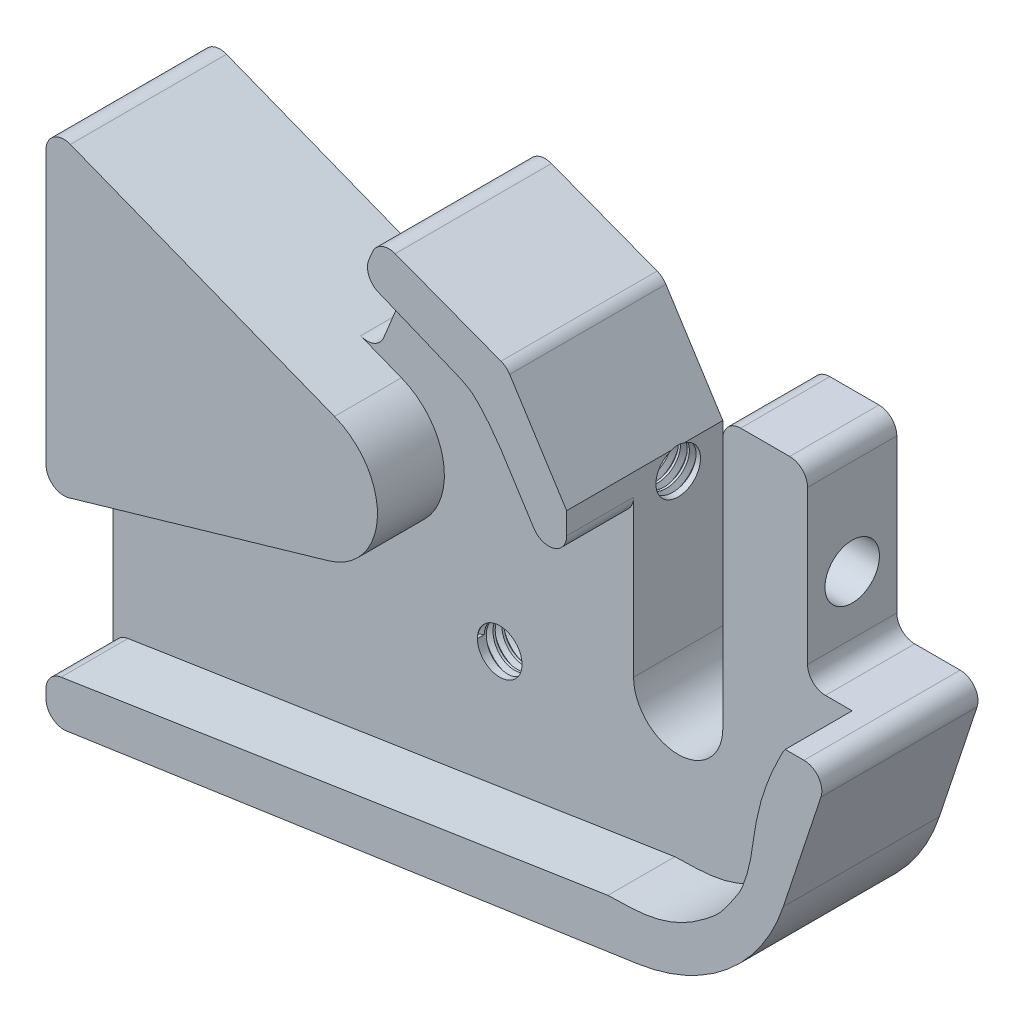
from build123d import *

# Parameters (mm, degrees)
BOSS_EXTRUDE1_DEPTH             = 10
SKETCH1_3_R                     = 7.578000113984699
BOSS_EXTRUDE2_DEPTH             = 17.5
FILLET1_R                       = 2
SKETCH4_R                       = 3.049999999999998
CUT_EXTRUDE2_DEPTH              = 30
TAP_DRILL_FOR_M6X1_0_TAP3_D     = 5
TAP_DRILL_FOR_M6X1_0_TAP3_DEPTH = 30
TAP_DRILL_FOR_M6X1_0_TAP3_TIP   = 1.5021515475689007
THREAD2_PITCH                   = 1
TAP_DRILL_FOR_M6X1_0_TAP4_D     = 5
TAP_DRILL_FOR_M6X1_0_TAP4_DEPTH = 30
TAP_DRILL_FOR_M6X1_0_TAP4_TIP   = 1.5021515475689007
THREAD3_PITCH                   = 1


with BuildPart() as part:
    # Sketch1 → Boss-Extrude1 (new body)
    with BuildSketch(Plane.XY):
        with BuildLine():
            Line((78.96827475522947, 38.5935556342534), (78.96827475522947, 42.187825253742076))
            Line((78.96827475522947, 42.187825253742076), (77.94135898527813, 43.80236991179886))
            Line((77.94135898527813, 43.80236991179886), (74.33675739276399, 49.46962171171273))
            ThreePointArc((74.33675739276399, 49.469621711712726), (63.68877245881805, 32.62392048177763), (72.57453232318737, 14.785744994510448))
            Line((72.57453232318733, 14.785744994510328), (83.59996436724236, 16.48818112450211))
            add(Edge.make_bspline(
                [(83.59996436724236, 16.48818112450211), (85.41724211796233, 16.537565687608662), (87.87798883539779, 16.519220276594933), (90.67264688620305, 17.420541267562605), (92.39490917260518, 18.177313617681204), (94.09982159977741, 19.33727905205282), (95.76190532502258, 20.584169739397396), (96.83810880091103, 21.89338889229207), (97.57220809756222, 23.02149502182194), (98.2993424213877, 24.012698516640828), (98.8168110615546, 25.180735972728453), (99.33817141463199, 26.79477159166982), (99.7545174529146, 28.73305881299975), (99.97921580397463, 30.878234339552698), (100.41119186805446, 32.8730475280245), (100.84339117053995, 34.69276986008276), (101.41680498340376, 36.208847575811006), (101.85717784527547, 37.44613777913256), (102.35269954460531, 38.40363385947975), (102.63825521054652, 39.04344915294927), (102.75433193083815, 39.30094954555371)],
                knots=[0, 0, 0, 0, 0.15768366072338366, 0.20676134981541355, 0.2516981863893839, 0.31900050382694334, 0.38365759589069376, 0.42951420214431174, 0.46378751400899093, 0.4995429911697522, 0.5348783172354219, 0.5730312186558052, 0.6454047552386061, 0.7048490244263054, 0.7583603601988523, 0.8208523578081605, 0.8654225677826217, 0.8976768321542437, 0.9336890739628735, 0.9579711653352324, 0.9579711653352324, 0.9579711653352324, 0.9579711653352324], degree=3))
            ThreePointArc((102.75433193083765, 39.30094954555368), (102.4765938343829, 39.94591996858493), (102.17672020405834, 40.5809011514899))
            Line((102.17672020405828, 40.58090115148971), (98.46827475522947, 40.58090115148971))
            Line((98.46827475522947, 40.58090115148971), (98.46827475522947, 45.80868367128349))
            ThreePointArc((98.46827475522967, 45.80868367128356), (94.09398060149493, 49.19440635869487), (88.96827475522964, 51.273999356618106))
            Line((88.96827475522946, 51.27399935661806), (88.96827475522946, 43.59355563425329))
            Line((88.96827475522946, 43.59355563425329), (88.96827475522946, 38.59355563425329))
            Line((88.96827475522946, 38.59355563425329), (88.96827475522947, 31.5935556342533))
            Line((88.96827475522947, 31.5935556342533), (88.96827475522947, 26.59355563425329))
            Line((88.96827475522947, 26.59355563425329), (83.96827475522934, 26.59355563425329))
            Line((83.96827475522934, 26.59355563425329), (78.96827475522947, 26.59355563425329))
            Line((78.96827475522947, 26.59355563425329), (78.96827475522947, 31.5935556342533))
            Line((78.96827475522947, 31.5935556342533), (78.96827475522947, 38.5935556342534))
        make_face()
        with BuildLine():
            Line((88.96827475522947, 61.76545821531718), (88.96827475522946, 51.27399935661806))
            ThreePointArc((88.96827475522964, 51.273999356618106), (94.09398060149493, 49.19440635869487), (98.46827475522967, 45.80868367128356))
            Line((98.46827475522947, 45.80868367128349), (98.46827475522947, 48.738746542251306))
            ThreePointArc((98.4682747552292, 48.73874654225122), (95.87453273292697, 54.3654582153173), (98.46827475522939, 59.99216988838329))
            Line((98.46827475522947, 59.99216988838326), (98.46827475522947, 61.76545821531719))
            Line((98.46827475522947, 61.76545821531719), (88.96827475522947, 61.76545821531718))
        make_face()
        with BuildLine():
            Line((88.96827475522947, 26.59355563425329), (88.96827475522947, 31.5935556342533))
            ThreePointArc((88.96827475522946, 31.5935556342533), (87.50380866116215, 28.058021728320522), (83.96827475522934, 26.59355563425331))
            Line((83.96827475522934, 26.59355563425329), (88.96827475522947, 26.59355563425329))
        make_face()
        with BuildLine():
            ThreePointArc((83.96827475522934, 26.59355563425331), (80.43274084929669, 28.058021728320615), (78.96827475522949, 31.5935556342533))
            Line((78.96827475522947, 31.5935556342533), (78.96827475522947, 26.59355563425329))
            Line((78.96827475522947, 26.59355563425329), (83.96827475522934, 26.59355563425329))
        make_face()
        with BuildLine():
            ThreePointArc((72.57453232318737, 14.785744994510448), (63.68877245881805, 32.62392048177763), (74.33675739276399, 49.469621711712726))
            Line((74.33675739276399, 49.46962171171273), (71.54074542683735, 53.865587102003296))
            add(Edge.make_bspline(
                [(67.16681294608784, 58.3330475317527), (67.53066578937491, 58.1481584549403), (68.2162670427706, 57.829717753599304), (69.73754280760359, 56.337591134666624), (70.76711290567232, 54.998035868514116), (71.54074542683735, 53.865587102003296)],
                knots=[0, 0, 0, 0, 0.19417637174294056, 0.35338295041403034, 1, 1, 1, 1], degree=3))
            Line((67.16681294608784, 58.3330475317527), (56.03811631838445, 62.90331689854259))
            Line((56.03811631838445, 62.90331689854259), (50.21233359803197, 48.7174203330503))
            Line((50.21233359803197, 48.7174203330503), (52.95464713088683, 47.643030748312306))
            ThreePointArc((52.95464713088681, 47.64303074831224), (56.45026737101809, 44.85792603920894), (57.76830437309072, 40.58721795212874))
            ThreePointArc((57.76830437309072, 40.58721795212874), (56.24935802543311, 36.03595953446999), (52.30143900683574, 33.30922401118043))
            Line((52.30143900683574, 33.30922401118043), (40.01978708427511, 29.746673468318164))
            Line((40.019787084275116, 29.746673468318164), (40.019787084275116, 9.758969238608223))
            Line((40.019787084275116, 9.758969238608222), (72.57453232318733, 14.785744994510328))
        make_face()
        with BuildLine():
            ThreePointArc((98.46827475522939, 59.99216988838329), (95.87453273292697, 54.3654582153173), (98.4682747552292, 48.73874654225122))
            Line((98.46827475522947, 48.738746542251306), (98.46827475522947, 59.99216988838326))
        make_face()
        with BuildLine():
            Line((103.46354532841673, 40.58090115148971), (102.17672020405828, 40.58090115148971))
            ThreePointArc((102.17672020405834, 40.5809011514899), (102.4765938343829, 39.94591996858493), (102.75433193083765, 39.30094954555368))
            add(Edge.make_bspline(
                [(102.75433193083815, 39.30094954555371), (102.75897264404554, 39.3112443356707), (102.95995934230355, 39.75692901409369), (103.16502264568484, 40.201773447042875), (103.46354532841673, 40.58090115148971)],
                knots=[0.9579711653352324, 0.9579711653352324, 0.9579711653352324, 0.9579711653352324, 0.9589419562212246, 1, 1, 1, 1], degree=3))
        make_face()
        Polygon((20.622854324708126, 6.763890314810976), (40.019787084275116, 9.758969238608222), (40.019787084275116, 29.746673468318164), (20.622854324708115, 24.120186594388674), align=None)
    extrude(amount=BOSS_EXTRUDE1_DEPTH)

    # Sketch1<3> → Boss-Extrude2 (add)
    with BuildSketch(Plane.XY):
        with BuildLine():
            ThreePointArc((74.33675739276399, 49.469621711712726), (76.59709644010309, 50.514062904297106), (78.96827475522967, 51.27399935661819))
            Line((78.96827475522947, 51.27399935661824), (78.96827475522947, 51.504339637287444))
            Line((78.96827475522947, 51.504339637287444), (77.99321410117432, 53.03735628417434))
            Line((77.99321410117432, 53.03735628417434), (72.23104068023561, 62.09680067854197))
            Line((72.2310406802356, 62.09680067854197), (70.50082285395956, 62.75430218344684))
            Line((70.50082285395956, 62.75430218344684), (57.93755222306168, 67.52848103011922))
            Line((57.93755222306168, 67.52848103011922), (56.03811631838445, 62.90331689854259))
            Line((56.03811631838445, 62.90331689854259), (67.16681294608784, 58.3330475317527))
            add(Edge.make_bspline(
                [(67.16681294608784, 58.3330475317527), (67.53066578937491, 58.1481584549403), (68.2162670427706, 57.829717753599304), (69.73754280760359, 56.337591134666624), (70.76711290567232, 54.998035868514116), (71.54074542683735, 53.865587102003296)],
                knots=[0, 0, 0, 0, 0.19417637174294056, 0.35338295041403034, 1, 1, 1, 1], degree=3))
            Line((71.54074542683735, 53.865587102003296), (74.33675739276399, 49.46962171171273))
        make_face()
        with BuildLine():
            Line((78.96827475522947, 42.187825253742076), (78.96827475522947, 43.59355563425329))
            Line((78.96827475522947, 43.59355563425329), (78.96827475522947, 49.44154603091854))
            Line((78.96827475522947, 49.44154603091854), (78.96827475522947, 51.27399935661824))
            ThreePointArc((78.96827475522967, 51.27399935661819), (76.59709644010309, 50.514062904297106), (74.33675739276399, 49.469621711712726))
            Line((74.33675739276399, 49.46962171171273), (77.94135898527813, 43.80236991179886))
            Line((77.94135898527813, 43.80236991179886), (78.96827475522947, 42.187825253742076))
        make_face()
        with Locations((50.19030425910602, 40.58721795212874)):
            Circle(SKETCH1_3_R)
        with BuildLine():
            Line((52.95464713088683, 47.643030748312306), (50.21233359803197, 48.7174203330503))
            Line((50.21233359803197, 48.7174203330503), (40.01978708427513, 52.710678465331654))
            Line((40.01978708427513, 52.71067846533165), (40.01978708427513, 47.34063824296787))
            Line((40.01978708427513, 47.34063824296787), (44.49575262392416, 45.58703468895018))
            ThreePointArc((44.49575262392417, 45.58703468895018), (48.4005247200828, 47.95082949329833), (52.95464713088681, 47.64303074831224))
        make_face()
        with BuildLine():
            Line((40.01978708427513, 47.34063824296787), (40.019787084275116, 35.746673468318164))
            Line((40.01978708427511, 35.74667346831816), (43.63005434703988, 36.79390715299979))
            ThreePointArc((43.63005434703988, 36.79390715299979), (42.648765078906784, 41.32969523869845), (44.49575262392417, 45.58703468895018))
            Line((44.49575262392416, 45.58703468895018), (40.01978708427513, 47.34063824296787))
        make_face()
        with BuildLine():
            Line((40.019787084275116, 35.746673468318164), (40.019787084275116, 29.746673468318164))
            Line((40.01978708427511, 29.746673468318164), (52.30143900683574, 33.30922401118043))
            ThreePointArc((52.30143900683574, 33.30922401118043), (47.364634323302816, 33.55574050130448), (43.63005434703988, 36.79390715299979))
            Line((43.63005434703988, 36.79390715299979), (40.01978708427511, 35.74667346831816))
        make_face()
        with BuildLine():
            ThreePointArc((86.91969232047563, 11.50353324838408), (79.43931894006272, 11.799404368451647), (72.57453232318737, 14.785744994510448))
            Line((72.57453232318733, 14.785744994510328), (40.019787084275116, 9.758969238608222))
            Line((40.019787084275116, 9.758969238608223), (40.019787084275116, 4.613486235158945))
            Line((40.0197870842751, 4.613486235158943), (86.91969232047563, 11.50353324838408))
        make_face()
        with BuildLine():
            Line((83.59996436724236, 16.48818112450211), (72.57453232318733, 14.785744994510328))
            ThreePointArc((72.57453232318737, 14.785744994510448), (79.43931894006272, 11.799404368451647), (86.91969232047563, 11.50353324838408))
            ThreePointArc((86.91969232047563, 11.50353324838408), (97.02458409935274, 16.041943132016453), (103.24393055814997, 25.208498197040438))
            ThreePointArc((103.24393055814997, 25.208498197040438), (104.01478063177572, 28.35975489042779), (104.27393566811703, 31.593555634253295))
            ThreePointArc((104.27393566811703, 31.5935556342533), (103.89041284338643, 35.52144044742895), (102.75433193083765, 39.30094954555368))
            add(Edge.make_bspline(
                [(83.59996436724236, 16.48818112450211), (85.41724211796233, 16.537565687608662), (87.87798883539779, 16.519220276594933), (90.67264688620305, 17.420541267562605), (92.39490917260518, 18.177313617681204), (94.09982159977741, 19.33727905205282), (95.76190532502258, 20.584169739397396), (96.83810880091103, 21.89338889229207), (97.57220809756222, 23.02149502182194), (98.2993424213877, 24.012698516640828), (98.8168110615546, 25.180735972728453), (99.33817141463199, 26.79477159166982), (99.7545174529146, 28.73305881299975), (99.97921580397463, 30.878234339552698), (100.41119186805446, 32.8730475280245), (100.84339117053995, 34.69276986008276), (101.41680498340376, 36.208847575811006), (101.85717784527547, 37.44613777913256), (102.35269954460531, 38.40363385947975), (102.63825521054652, 39.04344915294927), (102.75433193083815, 39.30094954555371)],
                knots=[0, 0, 0, 0, 0.15768366072338366, 0.20676134981541355, 0.2516981863893839, 0.31900050382694334, 0.38365759589069376, 0.42951420214431174, 0.46378751400899093, 0.4995429911697522, 0.5348783172354219, 0.5730312186558052, 0.6454047552386061, 0.7048490244263054, 0.7583603601988523, 0.8208523578081605, 0.8654225677826217, 0.8976768321542437, 0.9336890739628735, 0.9579711653352324, 0.9579711653352324, 0.9579711653352324, 0.9579711653352324], degree=3))
        make_face()
        with BuildLine():
            Line((108.33603780990366, 40.58090115148971), (103.46354532841673, 40.58090115148971))
            add(Edge.make_bspline(
                [(102.75433193083815, 39.30094954555371), (102.75897264404554, 39.3112443356707), (102.95995934230355, 39.75692901409369), (103.16502264568484, 40.201773447042875), (103.46354532841673, 40.58090115148971)],
                knots=[0.9579711653352324, 0.9579711653352324, 0.9579711653352324, 0.9579711653352324, 0.9589419562212246, 1, 1, 1, 1], degree=3))
            ThreePointArc((102.75433193083765, 39.30094954555368), (103.89041284338643, 35.52144044742895), (104.27393566811703, 31.5935556342533))
            ThreePointArc((104.27393566811703, 31.593555634253295), (104.01478063177572, 28.35975489042779), (103.24393055814997, 25.208498197040438))
            Line((103.24393055815005, 25.208498197040413), (108.33603780990366, 40.58090115148971))
        make_face()
        Polygon((40.01978708427513, 47.34063824296787), (40.01978708427513, 52.71067846533165), (23.91329061275728, 59.02091682731907), (22.08936487086497, 54.365458215317176), align=None)
        Polygon((22.08936487086497, 54.365458215317176), (23.91329061275728, 59.02091682731907), (20.622854324708136, 60.31005114211189), (20.622854324708136, 54.940010919748126), align=None)
        Polygon((20.622854324708136, 30.12018659438867), (40.01978708427511, 35.74667346831816), (40.01978708427513, 47.34063824296787), (22.08936487086497, 54.365458215317176), (20.622854324708136, 54.940010919748126), align=None)
        Polygon((20.622854324708115, 24.120186594388674), (40.01978708427511, 29.746673468318164), (40.019787084275116, 35.746673468318164), (20.622854324708136, 30.12018659438867), align=None)
        Polygon((40.019787084275116, 4.613486235158945), (40.019787084275116, 9.758969238608223), (20.622854324708126, 6.763890314810976), (20.62285432470813, 6.463885488189208), (20.622854324708133, 1.7638903148109766), align=None)
    extrude(amount=BOSS_EXTRUDE2_DEPTH)

    # Fillet1
    fillet1_edges = [part.edges().sort_by_distance(p)[0] for p in [
        (108.33603780990366, 40.58090115148971, 8.75),
        (98.46827475522947, 61.76545821531719, 5),
        (88.96827475522947, 61.76545821531718, 5),
        (57.93755222306168, 67.52848103011922, 8.75),
        (56.03811631838445, 62.90331689854259, 13.75),
        (78.96827475522947, 42.187825253742076, 13.75),
        (20.62285432470813, 1.7638903148109768, 8.75),
        (50.21233359803197, 48.7174203330503, 5),
        (98.46827475522947, 40.58090115148971, 5),
        (20.62285432470813, 6.763890314810976, 13.75),
        (72.2310406802356, 62.09680067854197, 8.75),
        (20.622854324708115, 24.120186594388674, 13.75),
        (20.622854324708136, 60.31005114211189, 8.75),
    ]]
    fillet(fillet1_edges, radius=FILLET1_R)

    # Sketch4 → Cut-Extrude2 (cut)
    with BuildSketch(Plane.ZY.offset(-88.96827475522943)):
        with Locations((5, 49.09355563425338)):
            Circle(SKETCH4_R)
    extrude(amount=-CUT_EXTRUDE2_DEPTH, mode=Mode.SUBTRACT)

    # Tap Drill for M6x1.0 Tap3
    with Locations(Plane(origin=(88.968274755, 49.093555634, 5), x_dir=(0, 1, 0), z_dir=(1, 0, 0))):
        with Locations((0, 0)):
            Hole(TAP_DRILL_FOR_M6X1_0_TAP3_D / 2, depth=TAP_DRILL_FOR_M6X1_0_TAP3_DEPTH)
            with Locations((0, 0, -(TAP_DRILL_FOR_M6X1_0_TAP3_DEPTH + TAP_DRILL_FOR_M6X1_0_TAP3_TIP / 2))):  # 118° drill point
                Cone(0, TAP_DRILL_FOR_M6X1_0_TAP3_D / 2, TAP_DRILL_FOR_M6X1_0_TAP3_TIP, mode=Mode.SUBTRACT)

    # Thread2: the profile of Thread Profile2 profile screwed along a right-hand helix of 20 turns, 8 arcs to a turn; built about Z, then put on its axis
    thread2_z = Axis((0, 0, 0), (0, 0, 1))
    thread2_corners = [(2.4997, 0, -0.000173205), (3.041265875, 0, 0.312499998), (3.041265875, 0, 0.437499998), (2.4997, 0, 0.750173202)]
    with BuildLine(mode=Mode.PRIVATE) as thread2_profile:
        Line(thread2_corners[0], thread2_corners[1])
        Line(thread2_corners[1], thread2_corners[2])
        Line(thread2_corners[2], thread2_corners[3])
        Line(thread2_corners[3], thread2_corners[0])
    thread2_cap = Face(thread2_profile.wire())
    thread2_turn_angles = [0, 22.5, 45, 67.5, 90, 112.5, 135, 157.5, 180, 202.5, 225, 247.5, 270, 292.5, 315, 337.5, 360]
    thread2_turn_weights = [1, 0.9238795325112867, 1, 0.9238795325112867, 1, 0.9238795325112867, 1, 0.9238795325112867, 1, 0.9238795325112867, 1, 0.9238795325112867, 1, 0.9238795325112867, 1, 0.9238795325112867, 1]
    thread2_turn_rails = [Edge.make_bspline([Vector(p[0], p[1], 0).rotate(thread2_z, thread2_turn_angles[k]) / thread2_turn_weights[k] + Vector(0, 0, p[2] + THREAD2_PITCH * thread2_turn_angles[k] / 360) for k in range(17)], [0, 0, 0, 1, 1, 2, 2, 3, 3, 4, 4, 5, 5, 6, 6, 7, 7, 8, 8, 8], 2, thread2_turn_weights) for p in thread2_corners]
    thread2_turn_sides = [Face.make_surface_from_curves(thread2_turn_rails[p[0]], thread2_turn_rails[p[1]]) for p in [(0, 1), (1, 2), (2, 3), (3, 0)]]
    thread2 = Plane(origin=(78.968274755, 49.093555634, 5), x_dir=(0, 0, 1), z_dir=(-1, 0, 0)) * Solid(Shell([*[p.moved(Location((0, 0, THREAD2_PITCH * i))) for i in range(20) for p in thread2_turn_sides], thread2_cap, thread2_cap.rotate(thread2_z, 7200).moved(Location((0, 0, THREAD2_PITCH * 7200 / 360)))]))
    add(thread2, mode=Mode.SUBTRACT)

    # Tap Drill for M6x1.0 Tap4
    with Locations(Plane(origin=(63.968274755, 26.593555634, 10), x_dir=(1, 0, 0), z_dir=(0, 0, 1))):
        with Locations((0, 0)):
            Hole(TAP_DRILL_FOR_M6X1_0_TAP4_D / 2, depth=TAP_DRILL_FOR_M6X1_0_TAP4_DEPTH)
            with Locations((0, 0, -(TAP_DRILL_FOR_M6X1_0_TAP4_DEPTH + TAP_DRILL_FOR_M6X1_0_TAP4_TIP / 2))):  # 118° drill point
                Cone(0, TAP_DRILL_FOR_M6X1_0_TAP4_D / 2, TAP_DRILL_FOR_M6X1_0_TAP4_TIP, mode=Mode.SUBTRACT)

    # Thread3: the profile of Thread Profile3 profile screwed along a right-hand helix of 20 turns, 8 arcs to a turn; built about Z, then put on its axis
    thread3_z = Axis((0, 0, 0), (0, 0, 1))
    thread3_corners = [(2.4997, 0, -0.000173205), (3.041265875, 0, 0.312499999), (3.041265875, 0, 0.437499999), (2.4997, 0, 0.750173202)]
    with BuildLine(mode=Mode.PRIVATE) as thread3_profile:
        Line(thread3_corners[0], thread3_corners[1])
        Line(thread3_corners[1], thread3_corners[2])
        Line(thread3_corners[2], thread3_corners[3])
        Line(thread3_corners[3], thread3_corners[0])
    thread3_cap = Face(thread3_profile.wire())
    thread3_turn_angles = [0, 22.5, 45, 67.5, 90, 112.5, 135, 157.5, 180, 202.5, 225, 247.5, 270, 292.5, 315, 337.5, 360]
    thread3_turn_weights = [1, 0.9238795325112867, 1, 0.9238795325112867, 1, 0.9238795325112867, 1, 0.9238795325112867, 1, 0.9238795325112867, 1, 0.9238795325112867, 1, 0.9238795325112867, 1, 0.9238795325112867, 1]
    thread3_turn_rails = [Edge.make_bspline([Vector(p[0], p[1], 0).rotate(thread3_z, thread3_turn_angles[k]) / thread3_turn_weights[k] + Vector(0, 0, p[2] + THREAD3_PITCH * thread3_turn_angles[k] / 360) for k in range(17)], [0, 0, 0, 1, 1, 2, 2, 3, 3, 4, 4, 5, 5, 6, 6, 7, 7, 8, 8, 8], 2, thread3_turn_weights) for p in thread3_corners]
    thread3_turn_sides = [Face.make_surface_from_curves(thread3_turn_rails[p[0]], thread3_turn_rails[p[1]]) for p in [(0, 1), (1, 2), (2, 3), (3, 0)]]
    thread3 = Plane(origin=(63.968274755, 26.593555634, 10), x_dir=(-1, 0, 0), z_dir=(0, 0, -1)) * Solid(Shell([*[p.moved(Location((0, 0, THREAD3_PITCH * i))) for i in range(20) for p in thread3_turn_sides], thread3_cap, thread3_cap.rotate(thread3_z, 7200).moved(Location((0, 0, THREAD3_PITCH * 7200 / 360)))]))
    add(thread3, mode=Mode.SUBTRACT)


solid = part.part
